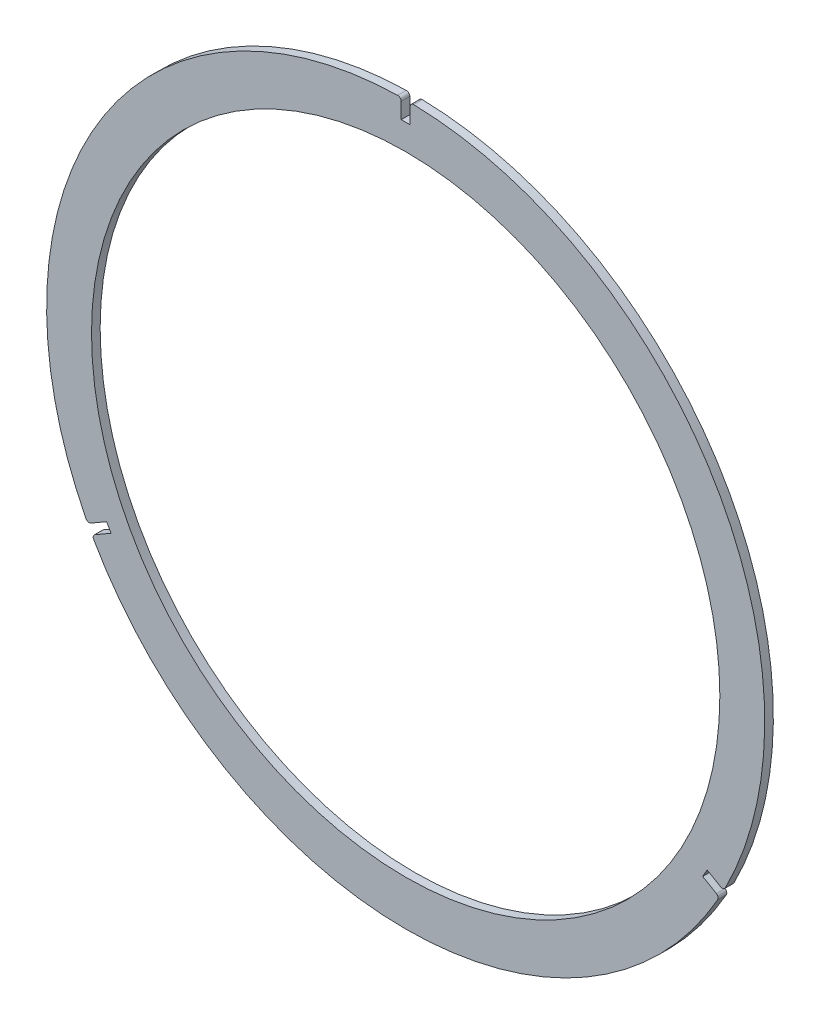
from build123d import *

# Parameters (mm, degrees)
SKETCH2_R           = 115.57
BOSS_EXTRUDE1_DEPTH = 1.5875
FILLET1_R           = 1.27


with BuildPart() as part:
    # Sketch2 → Boss-Extrude1 (new, symmetric)
    with BuildSketch(Plane.XY):
        with BuildLine():
            Line((-1.651, 128.513680847), (-1.651, 121.401680847))
            Line((-1.651, 121.401680847), (1.651, 121.401680847))
            Line((1.651, 121.401680847), (1.651, 128.513680847))
            ThreePointArc((1.651, 128.513680847), (113.44208216, 64.09028885), (116.977106193, -64.886930424))
            Line((116.977106193, -64.886930424), (110.898513443, -61.377453264))
            Line((110.898513443, -61.377453264), (109.247515795, -64.237065075))
            Line((109.247515795, -64.237065075), (115.406761019, -67.793106963))
            ThreePointArc((115.406761019, -67.793106963), (0, -135.636), (-115.406761019, -67.793106963))
            Line((-115.406761019, -67.793106963), (-108.367501139, -63.729462745))
            Line((-108.367501139, -63.729462745), (-110.018356602, -60.869763419))
            Line((-110.018356602, -60.869763419), (-116.977106193, -64.886930424))
            ThreePointArc((-116.977106193, -64.886930424), (-113.44208216, 64.09028885), (-1.651, 128.513680847))
        make_face()
        with Locations((0, -3.556)):
            Circle(SKETCH2_R, mode=Mode.SUBTRACT)
    extrude(amount=BOSS_EXTRUDE1_DEPTH, both=True)

    # Fillet1
    fillet1_edges = [part.edges().sort_by_distance(p)[0] for p in [
        (116.977106193, -64.886930424, 0),
        (115.406761019, -67.793106963, 0),
        (1.651, 128.513680847, 0),
        (-1.651, 128.513680847, 0),
        (-115.406761019, -67.793106963, 0),
        (-116.977106193, -64.886930424, 0),
    ]]
    fillet(fillet1_edges, radius=FILLET1_R)


solid = part.part
